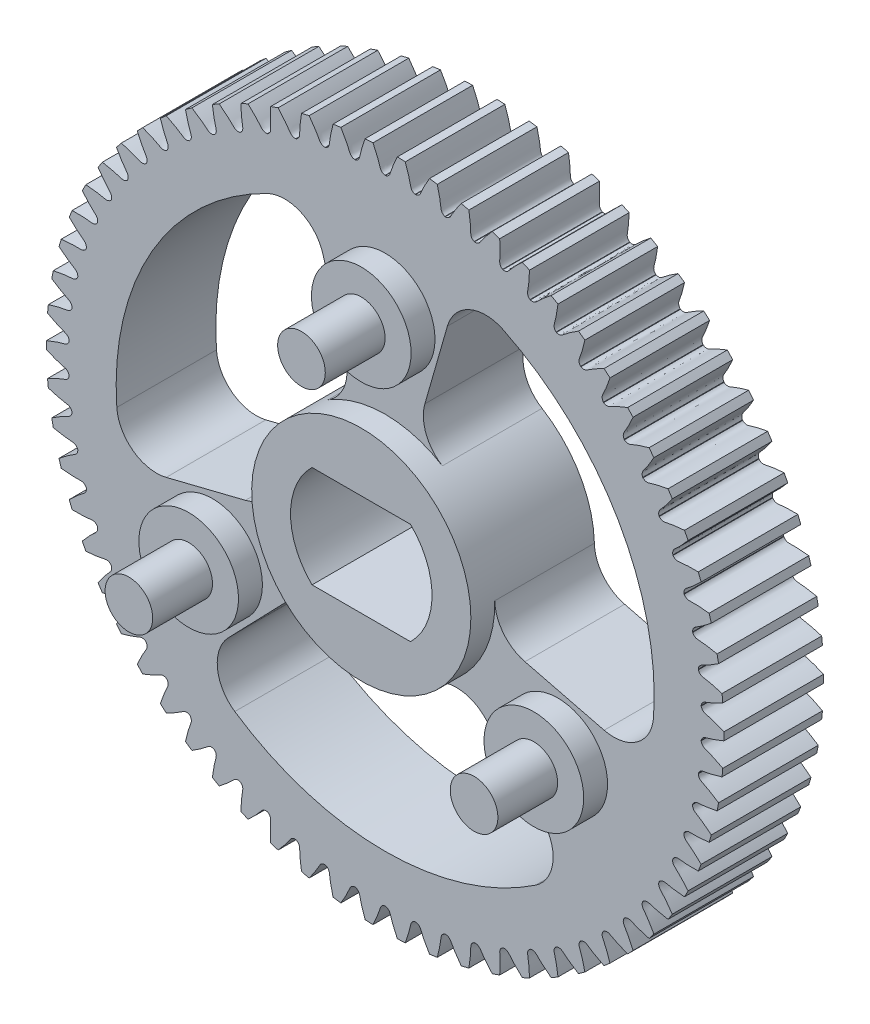
from build123d import *

# Parameters (mm, degrees)
SKETCH_1_R               = 17
EXTRUDE_1_DEPTH          = 5
CUT_EXTRUDE_1_DEPTH      = 25.556058316
PATTERN_CIRCULAR_1_COUNT = 66
SKETCH_4_R               = 5.5
EXTRUDE_2_DEPTH          = 1.2
SKETCH_6_R               = 1.195
EXTRUDE_3_DEPTH          = 4.2
SKETCH_8_R               = 2.5
EXTRUDE_4_DEPTH          = 1.2
PATTERN_CIRCULAR_2_COUNT = 3
CUT_EXTRUDE_2_DEPTH      = 31.9
CUT_EXTRUDE_START        = -31.9
CUT_EXTRUDE_3_DEPTH      = 31.9
FILLET_1_R               = 2
PATTERN_CIRCULAR_3_DEPTH = 5


# Read off the part's stored shape, not the designer's step: 阵列(圆周)3
with BuildPart() as part:
    # 草图1 → 凸台-拉伸1 (new body)
    with BuildSketch(Plane.XY):
        Circle(SKETCH_1_R)
    extrude(amount=EXTRUDE_1_DEPTH)

    # 草图2 → 切除-拉伸1 (cut, through all)
    with BuildSketch(Plane.XY):
        with BuildLine():
            ThreePointArc((0.01, 15.874931897), (0, 15.874935047), (-0.01, 15.874931897))
            add(Edge.make_bspline(
                [(-0.01, 15.874931897), (-0.215052905, 15.918014993), (-0.251336176, 16.098409666), (-0.32079043, 16.301264003), (-0.355664437, 16.399100591), (-0.394883505, 16.501903214), (-0.438417496, 16.609685307), (-0.48655087, 16.722269228), (-0.539471645, 16.839524586), (-0.597390821, 16.961298983), (-0.660507542, 17.087438218), (-0.72901894, 17.217780588), (-0.803117078, 17.352158665), (-0.88298962, 17.490398933), (-0.96881943, 17.632322038), (-1.06078448, 17.777742875), (-1.159057672, 17.926470722), (-1.263806698, 18.078309367), (-1.375193879, 18.233057239), (-1.493376026, 18.390507551), (-1.618504292, 18.550448435), (-1.750724047, 18.712663088), (-1.890174677, 18.876929921), (-2.088666504, 19.10148501), (-2.244734128, 19.267583995), (-2.35233524, 19.377727864)],
                knots=[0, 0, 0, 0, 0.103947241, 0.126880501, 0.151270631, 0.177117628, 0.204421495, 0.23318223, 0.263399834, 0.295074306, 0.328205647, 0.362793857, 0.398838935, 0.436340882, 0.475299698, 0.515715382, 0.557587935, 0.600917357, 0.645703647, 0.691946806, 0.739646833, 0.788803729, 0.839417494, 0.891488127, 1, 1, 1, 1], degree=3))
            ThreePointArc((-2.35233524, 19.377727864), (0, 19.519985098), (2.35233524, 19.377727864))
            add(Edge.make_bspline(
                [(0.01, 15.874931897), (0.215052905, 15.918014993), (0.251336176, 16.098409666), (0.32079043, 16.301264003), (0.355664437, 16.399100591), (0.394883505, 16.501903214), (0.438417496, 16.609685307), (0.48655087, 16.722269228), (0.539471645, 16.839524586), (0.597390821, 16.961298983), (0.660507542, 17.087438218), (0.72901894, 17.217780588), (0.803117078, 17.352158665), (0.88298962, 17.490398933), (0.96881943, 17.632322038), (1.06078448, 17.777742875), (1.159057672, 17.926470722), (1.263806698, 18.078309367), (1.375193879, 18.233057239), (1.493376026, 18.390507551), (1.618504292, 18.550448435), (1.750724047, 18.712663088), (1.890174677, 18.876929921), (2.088666504, 19.10148501), (2.244734128, 19.267583995), (2.35233524, 19.377727864)],
                knots=[0, 0, 0, 0, 0.103947241, 0.126880501, 0.151270631, 0.177117628, 0.204421495, 0.23318223, 0.263399834, 0.295074306, 0.328205647, 0.362793857, 0.398838935, 0.436340882, 0.475299698, 0.515715382, 0.557587935, 0.600917357, 0.645703647, 0.691946806, 0.739646833, 0.788803729, 0.839417494, 0.891488127, 1, 1, 1, 1], degree=3))
        make_face()
    cut_extrude_1 = extrude(amount=CUT_EXTRUDE_1_DEPTH, mode=Mode.SUBTRACT)

    # 阵列(圆周)1: 切除-拉伸1 ×66 about axis
    pattern_circular_1_axis = Axis((0, 0, 5), (0, 0, -1))
    for i in range(1, PATTERN_CIRCULAR_1_COUNT):
        add(cut_extrude_1.rotate(pattern_circular_1_axis, i * 360 / PATTERN_CIRCULAR_1_COUNT), mode=Mode.SUBTRACT)

    # 草图4 → 凸台-拉伸2 (add)
    with BuildSketch(Plane.XY.offset(5)):
        Circle(SKETCH_4_R)
    extrude(amount=EXTRUDE_2_DEPTH)

    # 草图6 → 凸台-拉伸3 (add)
    with BuildSketch(Plane.XY.offset(5)):
        with Locations((0, 10)):
            Circle(SKETCH_6_R)
    extrude_3 = extrude(amount=EXTRUDE_3_DEPTH)

    # 草图8 → 凸台-拉伸4 (add)
    with BuildSketch(Plane.XY.offset(5)):
        with Locations((0, 10)):
            Circle(SKETCH_8_R)
    extrude_4 = extrude(amount=EXTRUDE_4_DEPTH)

    # 阵列(圆周)2: 凸台-拉伸3, 凸台-拉伸4 ×3 about axis
    pattern_circular_2_axis = Axis((0, 0, 0), (0, 0, 1))
    add([extrude_3.rotate(pattern_circular_2_axis, i * 360 / PATTERN_CIRCULAR_2_COUNT) for i in range(1, PATTERN_CIRCULAR_2_COUNT)])
    add([extrude_4.rotate(pattern_circular_2_axis, i * 360 / PATTERN_CIRCULAR_2_COUNT) for i in range(1, PATTERN_CIRCULAR_2_COUNT)])

    # 草图9 → 切除-拉伸2 (cut)
    with BuildSketch(Plane.XY.offset(6.2)):
        with BuildLine():
            Line((2.469817807, 2.55), (-2.469817807, 2.55))
            ThreePointArc((-2.469817807, 2.55), (-3.55, 0), (-2.469817807, -2.55))
            Line((-2.469817807, -2.55), (2.469817807, -2.55))
            ThreePointArc((2.469817807, -2.55), (3.26881884, -1.384674472), (3.55, 0))
            ThreePointArc((3.55, 0), (3.26881884, 1.384674472), (2.469817807, 2.55))
        make_face()
    extrude(amount=-CUT_EXTRUDE_2_DEPTH, mode=Mode.SUBTRACT)

    # 草图10 → 切除-拉伸3 (cut)
    with BuildSketch(Plane.XY.offset(5).offset(CUT_EXTRUDE_START)):
        with BuildLine():
            Line((0, -13.5), (0, -5.5))
            ThreePointArc((0, -5.5), (-2.060336264, -5.0995112), (-3.820621038, -3.956368902))
            Line((-3.820621038, -3.956368902), (-9.377888001, -9.711087305))
            ThreePointArc((-9.377888001, -9.711087305), (-5.057189011, -12.516982037), (0, -13.5))
        make_face()
        with BuildLine():
            Line((9.377888001, -9.711087305), (3.820621038, -3.956368902))
            ThreePointArc((3.820621038, -3.956368902), (2.060336264, -5.0995112), (0, -5.5))
            Line((0, -5.5), (0, -13.5))
            ThreePointArc((0, -13.5), (5.057189011, -12.516982037), (9.377888001, -9.711087305))
        make_face()
    extrude(amount=CUT_EXTRUDE_3_DEPTH, mode=Mode.SUBTRACT)

    # 圆角1
    fillet_1_edges = [part.edges().sort_by_distance(p)[0] for p in [
        (9.377888001, -9.711087305, 2.5),
        (-9.377888001, -9.711087305, 2.5),
        (-3.820621038, -3.956368902, 2.5),
        (3.820621038, -3.956368902, 2.5),
    ]]
    fillet(fillet_1_edges, radius=FILLET_1_R)

    # 阵列(圆周)3 outline → 阵列(圆周)3 (cut)
    with BuildSketch(Plane.XY):
        with BuildLine():
            ThreePointArc((2.870959597, 4.691224892), (4.763139721, 2.75), (5.49819973, 0.140711498))
            ThreePointArc((5.49819973, 0.140711498), (5.937404867, -1.059504917), (7.013701296, -1.748712137))
            Line((7.013701296, -1.748712137), (10.98835813, -2.739705387))
            ThreePointArc((10.98835813, -2.739705387), (12.647990007, -2.416989819), (13.467367473, -0.938090271))
            ThreePointArc((13.467367473, -0.938090271), (11.691342951, 6.75), (5.921273731, 12.132127489))
            ThreePointArc((5.921273731, 12.132127489), (4.23082042, 12.161975562), (3.121524601, 10.88604998))
            Line((3.121524601, 10.88604998), (1.992421514, 6.948399565))
            ThreePointArc((1.992421514, 6.948399565), (2.051144261, 5.671695906), (2.870959597, 4.691224892))
        make_face()
        with BuildLine():
            ThreePointArc((-7.013701296, -1.748712137), (-5.937404867, -1.059504917), (-5.49819973, 0.140711498))
            ThreePointArc((-5.49819973, 0.140711498), (-4.763139721, 2.75), (-2.870959597, 4.691224892))
            ThreePointArc((-2.870959597, 4.691224892), (-2.051144261, 5.671695906), (-1.992421514, 6.948399565))
            Line((-1.992421514, 6.948399565), (-3.121524601, 10.88604998))
            ThreePointArc((-3.121524601, 10.88604998), (-4.23082042, 12.161975562), (-5.921273731, 12.132127489))
            ThreePointArc((-5.921273731, 12.132127489), (-11.691342951, 6.75), (-13.467367473, -0.938090271))
            ThreePointArc((-13.467367473, -0.938090271), (-12.647990007, -2.416989819), (-10.98835813, -2.739705387))
            Line((-10.98835813, -2.739705387), (-7.013701296, -1.748712137))
        make_face()
    extrude(amount=PATTERN_CIRCULAR_3_DEPTH, mode=Mode.SUBTRACT)


solid = part.part
